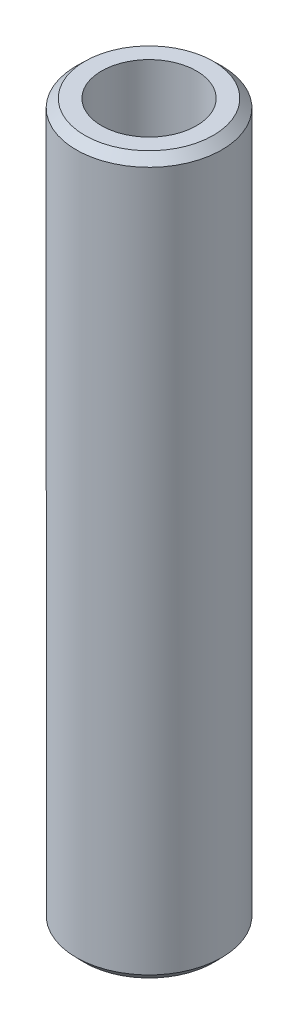
from build123d import *
from OCP.BRepFilletAPI import BRepFilletAPI_MakeChamfer

# Parameters (mm, degrees)
SKETCH1_R           = 35
BOSS_EXTRUDE1_DEPTH = 344.566195675
SKETCH2_R           = 22.8427712
CUT_EXTRUDE1_DEPTH  = 349.103236414
CHAMFER1_SIZE       = 3.98935197
CHAMFER1_SIZE2      = 4.107091637


with BuildPart() as part:
    # Sketch1 → Boss-Extrude1 (new body)
    with BuildSketch(Plane(origin=(0, 0, 0), x_dir=(1, 0, 0), z_dir=(0, 1, 0))):
        Circle(SKETCH1_R)
    extrude(amount=BOSS_EXTRUDE1_DEPTH)

    # Sketch2 → Cut-Extrude1 (cut, through all)
    with BuildSketch(Plane(origin=(0, 0, 0), x_dir=(1, 0, 0), z_dir=(0, 1, 0))):
        Circle(SKETCH2_R)
    extrude(amount=CUT_EXTRUDE1_DEPTH, mode=Mode.SUBTRACT)

    # Chamfer1: one chamfer whose edges measure the first distance from different faces: ONE call of the kernel's chamfer builder (chamfer() names one face for all edges)
    chamfer1_edges_1 = [part.edges().sort_by_distance(p)[0] for p in [
        (-35, 344.566195675, 0),
    ]]
    chamfer1_side_1 = [part.faces().sort_by_distance(p)[0] for p in [
        (-35, 172.283097837, 0),
    ]]
    chamfer1_edges_2 = [part.edges().sort_by_distance(p)[0] for p in [
        (-35, 0, 0),
    ]]
    chamfer1_side_2 = [part.faces().sort_by_distance(p)[0] for p in [
        (-34.010050506, 0, 0),
    ]]
    chamfer1 = BRepFilletAPI_MakeChamfer(part.part.solid().wrapped)
    for e in chamfer1_edges_1:
        chamfer1.Add(CHAMFER1_SIZE, CHAMFER1_SIZE2, e.wrapped, chamfer1_side_1[0].wrapped)  # the first distance lies on this face
    for e in chamfer1_edges_2:
        chamfer1.Add(CHAMFER1_SIZE, CHAMFER1_SIZE2, e.wrapped, chamfer1_side_2[0].wrapped)  # the first distance lies on this face
    add(Compound.cast(chamfer1.Shape()), mode=Mode.REPLACE)


solid = part.part
